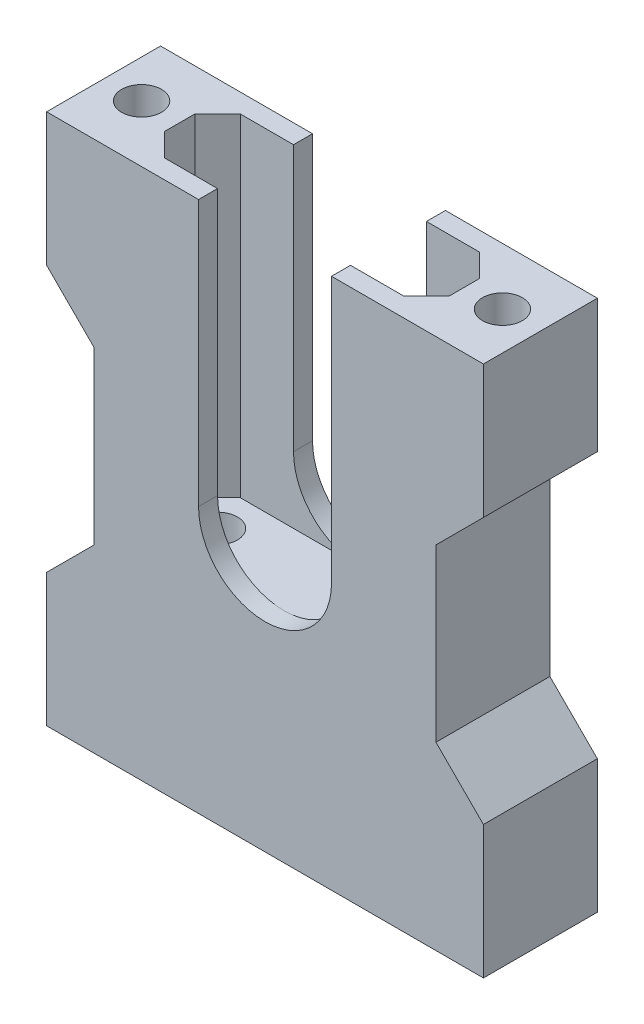
from build123d import *

# Parameters (mm, degrees)
DODANIE_WYCI_GNI_CIE1_DEPTH = 12
SZKIC2_R                    = 2.1
WYTNIJ_WYCI_GNI_CIE1_DEPTH  = 10
WYTNIJ_WYCI_GNI_CIE2_DEPTH  = 35
WYTNIJ_WYCI_GNI_CIE3_REACH  = 45.566
SZKIC4_R                    = 2.1
WYTNIJ_WYCI_GNI_CIE4_DEPTH  = 6


with BuildPart() as part:
    # Szkic1 → Dodanie-wyciągnięcie1 (new body)
    with BuildSketch(Plane.XY):
        with BuildLine():
            Line((-23, 0), (23, 0))
            Line((23, 0), (23, 14))
            Line((23, 14), (18, 19))
            Line((18, 19), (18, 37))
            Line((18, 37), (23, 42))
            Line((23, 42), (23, 56))
            Line((23, 56), (7, 56))
            Line((7, 56), (7, 28))
            ThreePointArc((7, 28), (0, 21), (-7, 28))
            Line((-7, 28), (-7, 56))
            Line((-7, 56), (-23, 56))
            Line((-23, 56), (-23, 42))
            Line((-23, 42), (-18, 37))
            Line((-18, 37), (-18, 19))
            Line((-18, 19), (-23, 14))
            Line((-23, 14), (-23, 0))
        make_face()
    extrude(amount=DODANIE_WYCI_GNI_CIE1_DEPTH)

    # Szkic2 → Wytnij-wyciągnięcie1 (cut)
    with BuildSketch(Plane(origin=(0, 56, 0), x_dir=(1, 0, 0), z_dir=(0, 1, 0))):
        with Locations((-19, -6)):
            Circle(SZKIC2_R)
        with Locations((19, -6)):
            Circle(SZKIC2_R)
    wytnij_wyci_gni_cie1 = extrude(amount=-WYTNIJ_WYCI_GNI_CIE1_DEPTH, mode=Mode.SUBTRACT)

    # Lustro1: Wytnij-wyciągnięcie1 across plane
    add(wytnij_wyci_gni_cie1.mirror(Plane(origin=(0, 28, 0), x_dir=(0, 0, 1), z_dir=(0, -1, 0))), mode=Mode.SUBTRACT)

    # Szkic3 → Wytnij-wyciągnięcie2 (cut)
    with BuildSketch(Plane(origin=(0, 56, 0), x_dir=(-1, 0, 0), z_dir=(0, -1, 0))):
        Polygon((12.6, -2), (-12.6, -2), (-15, -4.4), (-15, -7.6), (-12.6, -10), (12.6, -10), (15, -7.6), (15, -4.4), align=None)
    extrude(amount=WYTNIJ_WYCI_GNI_CIE2_DEPTH, mode=Mode.SUBTRACT)

    # Szkic4 → Wytnij-wyciągnięcie3 (cut, up to next)
    with BuildSketch(Plane(origin=(0, 21, 0), x_dir=(1, 0, 0), z_dir=(0, 1, 0)), mode=Mode.PRIVATE) as wytnij_wyci_gni_cie3_sk1:
        with Locations((11, -6)):
            Circle(SZKIC4_R)
    wytnij_wyci_gni_cie3_tool1 = extrude(wytnij_wyci_gni_cie3_sk1.sketch, amount=-WYTNIJ_WYCI_GNI_CIE3_REACH, mode=Mode.PRIVATE) & part.part
    # Szkic4 → Wytnij-wyciągnięcie3 (cut, up to next)
    with BuildSketch(Plane(origin=(0, 21, 0), x_dir=(1, 0, 0), z_dir=(0, 1, 0)), mode=Mode.PRIVATE) as wytnij_wyci_gni_cie3_sk2:
        with Locations((-11, -6)):
            Circle(SZKIC4_R)
    wytnij_wyci_gni_cie3_tool2 = extrude(wytnij_wyci_gni_cie3_sk2.sketch, amount=-WYTNIJ_WYCI_GNI_CIE3_REACH, mode=Mode.PRIVATE) & part.part
    add(wytnij_wyci_gni_cie3_tool1.solids().sort_by_distance((11, 21, 6))[0], mode=Mode.SUBTRACT)
    add(wytnij_wyci_gni_cie3_tool2.solids().sort_by_distance((-11, 21, 6))[0], mode=Mode.SUBTRACT)

    # Szkic5 → Wytnij-wyciągnięcie4 (cut)
    with BuildSketch(Plane.XZ):
        Polygon((11, 1.727608008), (14.7, 3.863804004), (14.7, 8.136195996), (11, 10.272391992), (7.3, 8.136195996), (7.3, 3.863804004), align=None)
        Polygon((-7.3, 3.863804004), (-11, 1.727608008), (-14.7, 3.863804004), (-14.7, 8.136195996), (-11, 10.272391992), (-7.3, 8.136195996), align=None)
    extrude(amount=-WYTNIJ_WYCI_GNI_CIE4_DEPTH, mode=Mode.SUBTRACT)


solid = part.part
